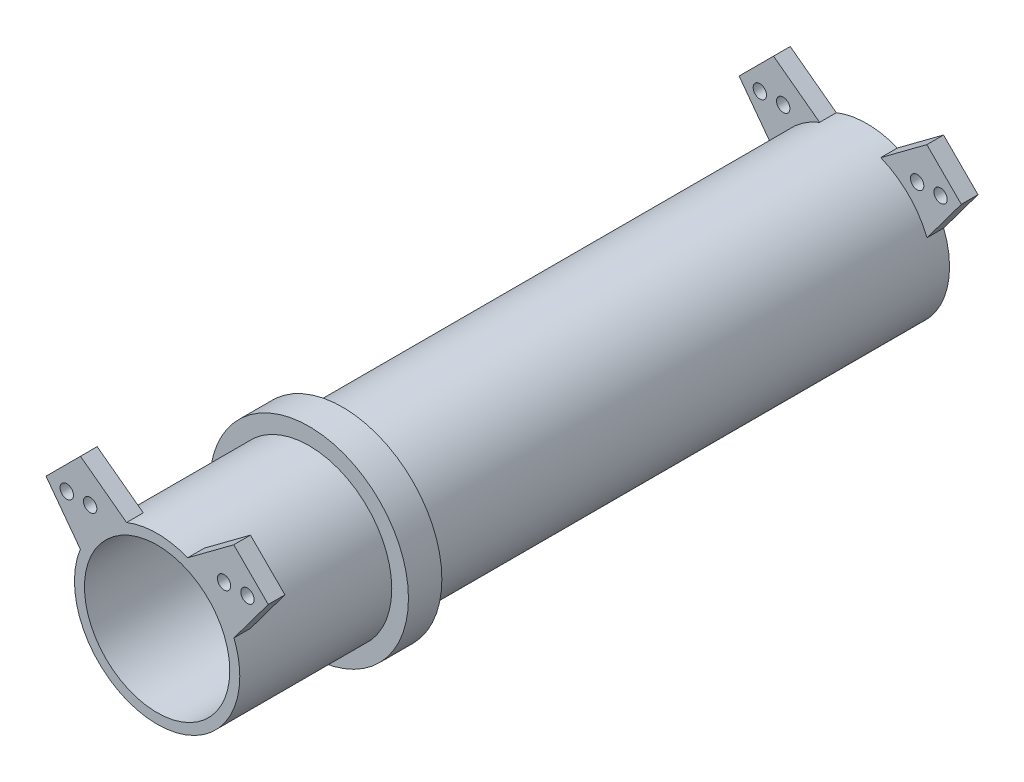
from build123d import *

# Parameters (mm, degrees)
BOSS_EXTRUDE1_DEPTH      = 120
BOSS_EXTRUDE1_DEPTH_BACK = 90
SKETCH1_R                = 24.75
SKETCH1_R_2              = 21.75
BOSS_EXTRUDE3_START      = 72
SKETCH5_R                = 29.75
SKETCH5_R_2              = 21.75
BOSS_EXTRUDE3_DEPTH      = 5
SKETCH7_R                = 24.75
SKETCH7_R_2              = 21.75
BOSS_EXTRUDE4_DEPTH      = 2.5
BOSS_EXTRUDE5_START      = -5
SKETCH6_R                = 2
BOSS_EXTRUDE5_DEPTH      = 5
MIRROR2_START            = 67
MIRROR2_OUTLINE_R        = 29.75
MIRROR2_OUTLINE_R_2      = 24.75
MIRROR2_DEPTH            = 5
MIRROR2_START_2          = -90
MIRROR2_2_OUTLINE_R      = 2
MIRROR2_2_DEPTH          = 5


# Read off the part's stored shape, not the designer's step: Mirror2
with BuildPart() as part:
    # Sketch1 → Boss-Extrude1 (new, two sides: drawn at the far end of the back side and taken through both)
    with BuildSketch(Plane.XY.offset(-BOSS_EXTRUDE1_DEPTH_BACK)):
        Circle(SKETCH1_R)
        Circle(SKETCH1_R_2, mode=Mode.SUBTRACT)
    extrude(amount=BOSS_EXTRUDE1_DEPTH + BOSS_EXTRUDE1_DEPTH_BACK)

    # Sketch5 → Boss-Extrude3 (add)
    with BuildSketch(Plane.XY.offset(BOSS_EXTRUDE3_START)):
        Circle(SKETCH5_R)
        Circle(SKETCH5_R_2, mode=Mode.SUBTRACT)
    extrude(amount=BOSS_EXTRUDE3_DEPTH)

    # Sketch7 → Boss-Extrude4 (add, symmetric)
    with BuildSketch(Plane.XY.offset(120)):
        Circle(SKETCH7_R)
        Circle(SKETCH7_R_2, mode=Mode.SUBTRACT)
    extrude(amount=BOSS_EXTRUDE4_DEPTH, both=True)

    # Sketch6 → Boss-Extrude5 (add)
    with BuildSketch(Plane.XY.offset(122.5).offset(BOSS_EXTRUDE5_START)):
        with BuildLine():
            Line((-22.997666259, 9.147122314), (-33.267406372, 22.947582732))
            Line((-33.267406372, 22.947582732), (-22.947582732, 33.267406372))
            Line((-22.947582732, 33.267406372), (-9.147122314, 22.997666259))
            ThreePointArc((-9.147122314, 22.997666259), (-17.500892834, 17.500892834), (-22.997666259, 9.147122314))
        make_face()
        with Locations((-20.04683438, 22.097086912)):
            Circle(SKETCH6_R, mode=Mode.SUBTRACT)
        with Locations((-27.04683438, 22.097086912)):
            Circle(SKETCH6_R, mode=Mode.SUBTRACT)
    boss_extrude5 = extrude(amount=BOSS_EXTRUDE5_DEPTH)

    # Mirror1: Boss-Extrude5 across plane
    add(boss_extrude5.mirror(Plane(origin=(0, 0, 0), x_dir=(0, 0, 1), z_dir=(1, 0, 0))))

    # Mirror2 outline → Mirror2 (add)
    with BuildSketch(Plane.XY.offset(MIRROR2_START)):
        Circle(MIRROR2_OUTLINE_R)
        Circle(MIRROR2_OUTLINE_R_2, mode=Mode.SUBTRACT)
    extrude(amount=MIRROR2_DEPTH)

    # Mirror2 2 outline → Mirror2 2 (add)
    # profile 1 of 2: a face of its own
    with BuildSketch(Plane.XY.offset(MIRROR2_START_2)):
        with BuildLine():
            Line((22.997666259, 9.147122314), (33.267406372, 22.947582732))
            Line((33.267406372, 22.947582732), (22.947582732, 33.267406372))
            Line((22.947582732, 33.267406372), (9.147122314, 22.997666259))
            ThreePointArc((9.147122314, 22.997666259), (17.500892834, 17.500892834), (22.997666259, 9.147122314))
        make_face()
        with Locations((20.04683438, 22.097086912)):
            Circle(MIRROR2_2_OUTLINE_R, mode=Mode.SUBTRACT)
        with Locations((27.04683438, 22.097086912)):
            Circle(MIRROR2_2_OUTLINE_R, mode=Mode.SUBTRACT)
    # profile 2 of 2: a face of its own
    with BuildSketch(Plane.XY.offset(MIRROR2_START_2)):
        with BuildLine():
            Line((-33.267406372, 22.947582732), (-22.997666259, 9.147122314))
            ThreePointArc((-22.997666259, 9.147122314), (-17.500892834, 17.500892834), (-9.147122314, 22.997666259))
            Line((-9.147122314, 22.997666259), (-22.947582732, 33.267406372))
            Line((-22.947582732, 33.267406372), (-33.267406372, 22.947582732))
        make_face()
        with Locations((-20.04683438, 22.097086912)):
            Circle(MIRROR2_2_OUTLINE_R, mode=Mode.SUBTRACT)
        with Locations((-27.04683438, 22.097086912)):
            Circle(MIRROR2_2_OUTLINE_R, mode=Mode.SUBTRACT)
    extrude(amount=MIRROR2_2_DEPTH)


solid = part.part
